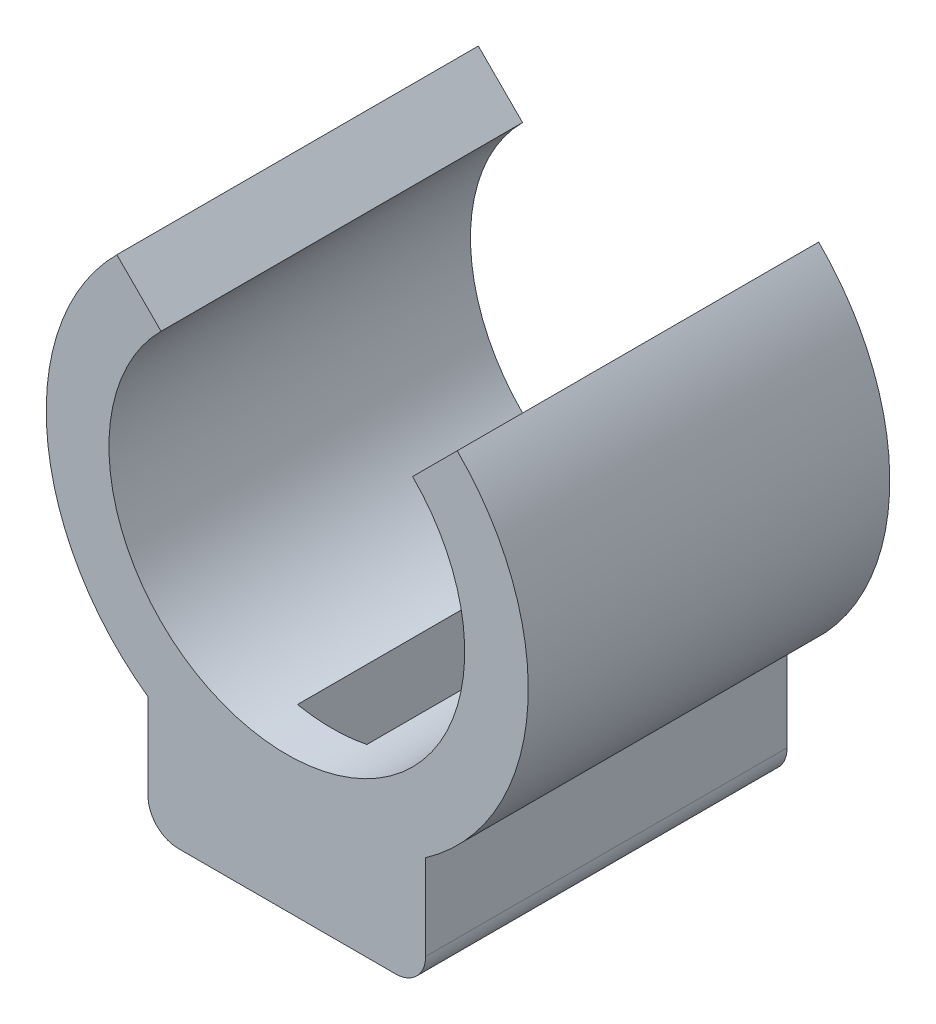
from build123d import *

# Parameters (mm, degrees)
BOSS_EXTRUDE1_DEPTH      = 2
BOSS_EXTRUDE1_DEPTH_BACK = 0.2
SKETCH1_W                = 4.602701487
SKETCH1_H                = 5.995472756
SKETCH1_W_2              = 1.15
SKETCH1_H_2              = 4.4
BOSS_EXTRUDE2_REACH      = 8.943
SKETCH4_W                = 1.15
SKETCH4_H                = 4.5
CUT_EXTRUDE2_DEPTH       = 2.2
FILLET1_R                = 0.5
FILLET2_R                = 0.3


with BuildPart() as part:
    # Sketch1 → Boss-Extrude1 (new, two sides: drawn at the far end of the back side and taken through both)
    with BuildSketch(Plane(origin=(0, 0, 0), x_dir=(1, 0, 0), z_dir=(0, 1, 0)).offset(-BOSS_EXTRUDE1_DEPTH_BACK)):
        with Locations((0.573649256, 2.197554863)):
            Rectangle(SKETCH1_W, SKETCH1_H)
        with Locations((0.575, 2.2)):
            Rectangle(SKETCH1_W_2, SKETCH1_H_2, mode=Mode.SUBTRACT)
    extrude(amount=BOSS_EXTRUDE1_DEPTH + BOSS_EXTRUDE1_DEPTH_BACK)

    # Boss-Extrude2: up to this face of the body (flat: up to its plane)
    boss_extrude2_end = Plane(part.part.faces().sort_by_distance((0.573649257, 0.9, -5.195291241))[0])
    # Sketch3 → Boss-Extrude2 (add, up to the picked face)
    with BuildSketch(Plane.XY.offset(0.800181515), mode=Mode.PRIVATE) as boss_extrude2_sk1:
        with BuildLine():
            Line((-2.24541451, 7.819063766), (-1.512315748, 7.085965005))
            ThreePointArc((-1.512315748, 7.085965005), (0.573649257, 2.05), (2.659614261, 7.085965005))
            Line((2.659614261, 7.085965005), (3.399551047, 7.82590179))
            ThreePointArc((3.399551047, 7.82590179), (0.585339186, 0.994625964), (-2.24541451, 7.819063766))
        make_face()
    boss_extrude2_tool1 = split(extrude(boss_extrude2_sk1.sketch, amount=-BOSS_EXTRUDE2_REACH, mode=Mode.PRIVATE), bisect_by=boss_extrude2_end, keep=Keep.BOTH, mode=Mode.PRIVATE)
    add(boss_extrude2_tool1.solids().sort_by(Axis((-1.953222, 7.378157, 0.800182), (0, 0, -1)))[0])

    # Sketch4 → Cut-Extrude2 (cut)
    with BuildSketch(Plane.XZ):
        with Locations((0.575, -2.2)):
            Rectangle(SKETCH4_W, SKETCH4_H)
    extrude(amount=-CUT_EXTRUDE2_DEPTH, mode=Mode.SUBTRACT)

    # Fillet1
    fillet1_edges = [part.edges().sort_by_distance(p)[0] for p in [
        (-1.727701487, -0.2, -2.197554863),
        (2.875, -0.2, -2.197554863),
    ]]
    fillet(fillet1_edges, radius=FILLET1_R)

    # Fillet2
    # the kernel refuses this fillet: 0.3 mm, written as the material it takes off along each edge
    with BuildSketch(Plane(origin=(1.15, -0.2, -4.4), x_dir=(0, 0, -1), z_dir=(-1, 0, 0)), Plane(origin=(0, -0.2, 0), x_dir=(0, 0, 1), z_dir=(1, 0, 0))) as fillet2_piece_1:
        with BuildLine():
            CenterArc((0.282842712, -0.3), FILLET2_R, 90, 70.528779366)
            Line((0, -0.2), (-0.005656854, -0.198))
            ThreePointArc((-0.005656854, -0.198), (-0.006, -0.1), (-0.006, 0))
            Line((-0.006, 0), (0, 0.006))
            Line((0, 0.006), (0.282842712, 0.006))
            Line((0.282842712, 0.006), (0.282842712, 0))
        make_face()
    extrude(amount=1.15, mode=Mode.SUBTRACT)


solid = part.part
